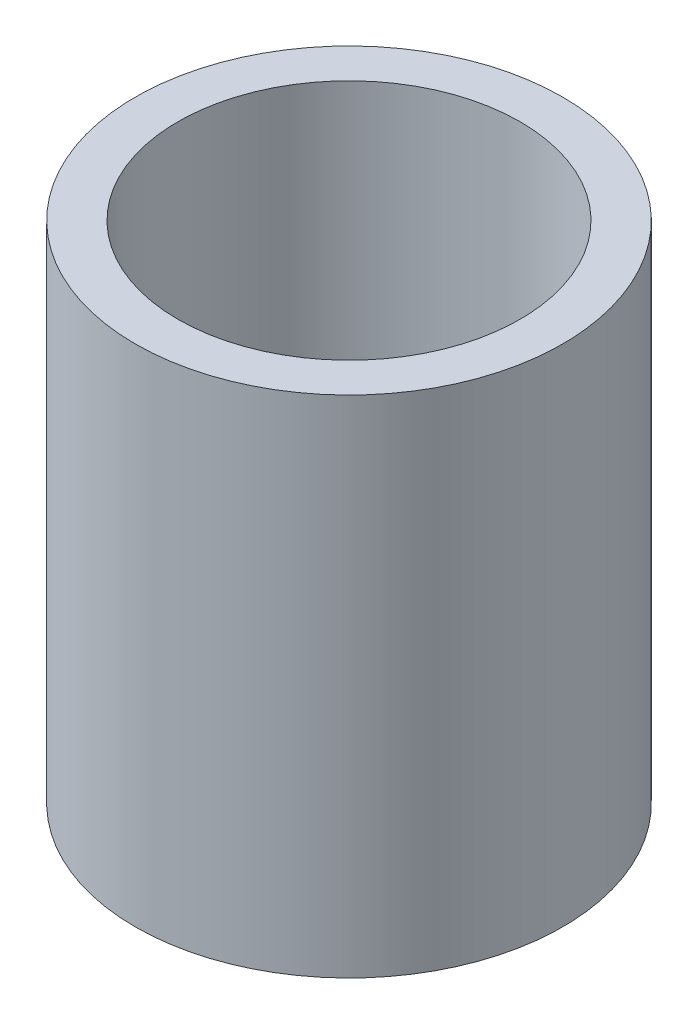
from build123d import *

# Parameters (mm, degrees)
SKETCH1_R           = 27.5
BOSS_EXTRUDE1_DEPTH = 64.947973413
SKETCH2_R           = 22.015323483
CUT_EXTRUDE1_DEPTH  = 76.701646286


with BuildPart() as part:
    # Sketch1 → Boss-Extrude1 (new body)
    with BuildSketch(Plane(origin=(0, 0, 0), x_dir=(1, 0, 0), z_dir=(0, 1, 0))):
        Circle(SKETCH1_R)
    extrude(amount=BOSS_EXTRUDE1_DEPTH)

    # Sketch2 → Cut-Extrude1 (cut, through all)
    with BuildSketch(Plane(origin=(0, 0, 0), x_dir=(1, 0, 0), z_dir=(0, 1, 0))):
        Circle(SKETCH2_R)
    extrude(amount=CUT_EXTRUDE1_DEPTH, mode=Mode.SUBTRACT)


solid = part.part
